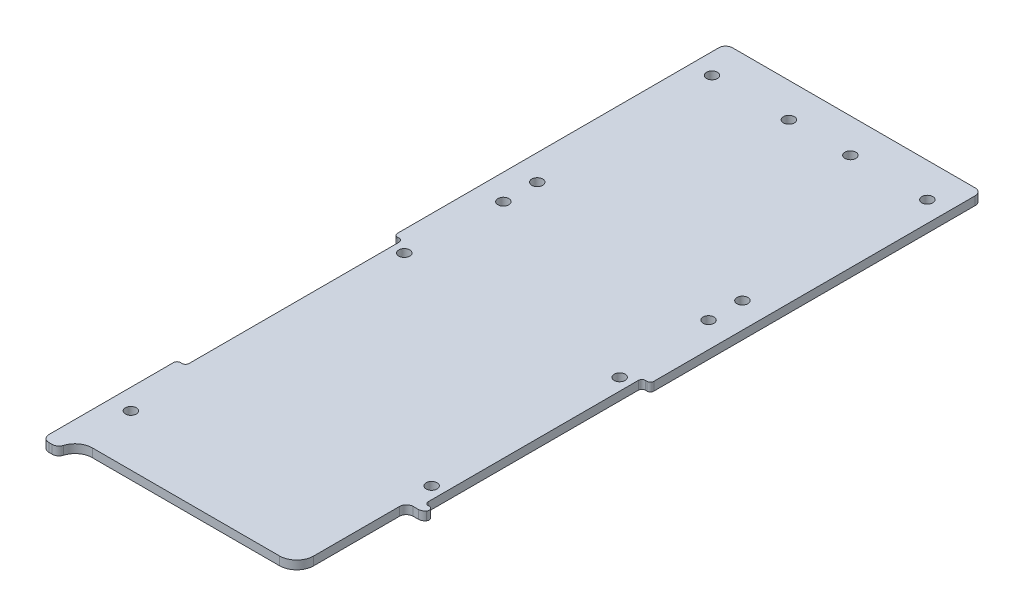
from build123d import *

# Parameters (mm, degrees)
SKETCH1_R               = 2.032
BOSS_EXTRUDE1_DEPTH     = 3.175
FILLET1_R               = 2.54
FILLET2_R               = 2.54
FILLET3_R               = 6.35
CUT_EXTRUDE1_DEPTH      = 136.673215063
FILLET4_R               = 6.35
FILLET5_R               = 2.54
SKETCH3_R               = 2.032
CUT_EXTRUDE2_DEPTH      = 136.673215063
CUT_EXTRUDE3_DEPTH      = 136.673215063
CUT_EXTRUDE3_DEPTH_BACK = 136.673215063
SKETCH4_W               = 3.175
SKETCH4_H               = 80.645
FILLET6_R               = 1.27


with BuildPart() as part:
    # Sketch1 → Boss-Extrude1 (new body)
    with BuildSketch(Plane(origin=(0, 0, 0), x_dir=(1, 0, 0), z_dir=(0, 1, 0))):
        Polygon((47.625, 127), (-47.625, 127), (-47.625, -127), (-41.275, -127), (-41.275, -120.65), (41.275, -120.65), (41.275, -127), (47.625, -127), align=None)
        with Locations((-39.999684148, -101.6)):
            Circle(SKETCH1_R, mode=Mode.SUBTRACT)
        with Locations((39.999684148, -69.85)):
            Circle(SKETCH1_R, mode=Mode.SUBTRACT)
        with Locations((-39.999684148, 0)):
            Circle(SKETCH1_R, mode=Mode.SUBTRACT)
        with Locations((-39.999684148, 114.3)):
            Circle(SKETCH1_R, mode=Mode.SUBTRACT)
        with Locations((-11.424684148, 114.3)):
            Circle(SKETCH1_R, mode=Mode.SUBTRACT)
        with Locations((39.999684148, 0)):
            Circle(SKETCH1_R, mode=Mode.SUBTRACT)
        with Locations((11.424684148, 114.3)):
            Circle(SKETCH1_R, mode=Mode.SUBTRACT)
        with Locations((39.999684148, 114.3)):
            Circle(SKETCH1_R, mode=Mode.SUBTRACT)
    extrude(amount=BOSS_EXTRUDE1_DEPTH)

    # Fillet1
    fillet1_edges = [part.edges().sort_by_distance(p)[0] for p in [
        (-47.625, 1.5875, -127),
        (47.625, 1.5875, -127),
        (47.625, 1.5875, 127),
        (-47.625, 1.5875, 127),
    ]]
    fillet(fillet1_edges, radius=FILLET1_R)

    # Fillet2
    fillet2_edges = [part.edges().sort_by_distance(p)[0] for p in [
        (41.275, 1.5875, 127),
        (-41.275, 1.5875, 127),
    ]]
    fillet(fillet2_edges, radius=FILLET2_R)

    # Fillet3
    fillet3_edges = [part.edges().sort_by_distance(p)[0] for p in [
        (41.275, 1.5875, 120.65),
        (-41.275, 1.5875, 120.65),
    ]]
    fillet(fillet3_edges, radius=FILLET3_R)

    # Sketch2 → Cut-Extrude1 (cut, through all)
    with BuildSketch(Plane.XZ):
        with BuildLine():
            Line((40.64508, 123.578690235), (40.64508, 79.88808))
            Line((40.64508, 79.88808), (47.625, 79.88808))
            Line((47.625, 79.88808), (47.625, 124.46))
            ThreePointArc((47.625, 124.46), (46.881051224, 126.256051224), (45.085, 127))
            Line((45.085, 127), (43.815, 127))
            ThreePointArc((43.815, 127), (42.297059666, 126.496530663), (41.380880287, 125.185714286))
            ThreePointArc((41.380880287, 125.185714286), (41.069166069, 124.356476684), (40.64508, 123.578690235))
        make_face()
    extrude(amount=-CUT_EXTRUDE1_DEPTH, mode=Mode.SUBTRACT)

    # Fillet4
    fillet4_edges = [part.edges().sort_by_distance(p)[0] for p in [
        (40.64508, 1.5875, 123.578690235),
    ]]
    fillet(fillet4_edges, radius=FILLET4_R)

    # Fillet5
    fillet5_edges = [part.edges().sort_by_distance(p)[0] for p in [
        (47.625, 1.5875, 79.88808),
        (40.64508, 1.5875, 79.88808),
    ]]
    fillet(fillet5_edges, radius=FILLET5_R)

    # Sketch3 → Cut-Extrude2 (cut, through all)
    with BuildSketch(Plane.XZ):
        with Locations((-38.108430746, -34.913768806)):
            Circle(SKETCH3_R)
        with Locations((-38.108430746, -47.490173279)):
            Circle(SKETCH3_R)
        with Locations((38.108430746, -47.490173279)):
            Circle(SKETCH3_R)
        with Locations((38.108430746, -34.913768806)):
            Circle(SKETCH3_R)
    extrude(amount=-CUT_EXTRUDE2_DEPTH, mode=Mode.SUBTRACT)

    # Sketch4 → Cut-Extrude3 (cut, two sides: drawn at the far end of the back side and taken through both)
    with BuildSketch(Plane(origin=(0, 3.175, 0), x_dir=(1, 0, 0), z_dir=(0, 1, 0)).offset(-CUT_EXTRUDE3_DEPTH_BACK)):
        with Locations((-46.0375, -36.5125)):
            Rectangle(SKETCH4_W, SKETCH4_H)
        with Locations((46.0375, -36.5125)):
            Rectangle(SKETCH4_W, SKETCH4_H)
    extrude(amount=CUT_EXTRUDE3_DEPTH + CUT_EXTRUDE3_DEPTH_BACK, mode=Mode.SUBTRACT)

    # Fillet6
    fillet6_edges = [part.edges().sort_by_distance(p)[0] for p in [
        (-44.45, 1.5875, -3.81),
        (-47.625, 1.5875, -3.81),
        (-47.625, 1.5875, 76.835),
        (-44.45, 1.5875, 76.835),
        (44.45, 1.5875, 76.835),
        (47.625, 1.5875, 76.835),
        (44.45, 1.5875, -3.81),
        (47.625, 1.5875, -3.81),
    ]]
    fillet(fillet6_edges, radius=FILLET6_R)


solid = part.part
